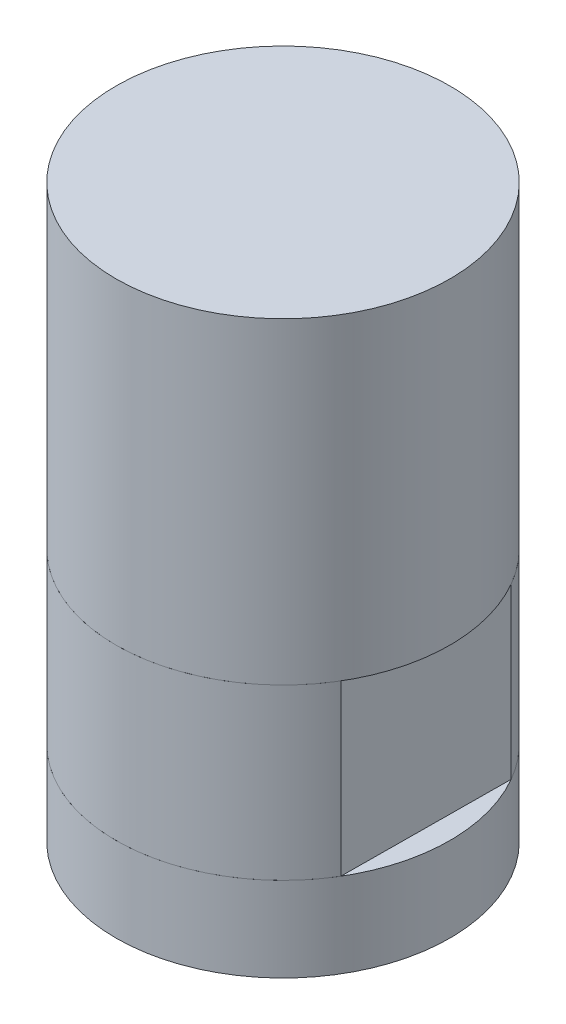
from build123d import *

# Parameters (mm, degrees)
SKETCH1_R           = 3.95
BOSS_EXTRUDE1_DEPTH = 2
BOSS_EXTRUDE2_DEPTH = 4
SKETCH4_R           = 3.95
BOSS_EXTRUDE3_DEPTH = 2
CUT_EXTRUDE1_DEPTH  = 10.757304956
SKETCH6_R           = 3.95
BOSS_EXTRUDE4_DEPTH = 5.5


with BuildPart() as part:
    # Sketch1 → Boss-Extrude1 (new body)
    with BuildSketch(Plane(origin=(0, 0, 0), x_dir=(1, 0, 0), z_dir=(0, 1, 0))):
        Circle(SKETCH1_R)
    extrude(amount=BOSS_EXTRUDE1_DEPTH)


with BuildPart() as body_2:
    # Sketch3 → Boss-Extrude2 (new body)
    with BuildSketch(Plane(origin=(0, 2, 0), x_dir=(1, 0, 0), z_dir=(0, 1, 0))):
        with BuildLine():
            Line((-2.025641026, 3.391058601), (1.974358974, 3.421170361))
            ThreePointArc((1.974358974, 3.421170361), (2.793071786, 2.793071786), (3.421170361, 1.974358974))
            Line((3.421170361, 1.974358974), (3.391058601, -2.025641026))
            ThreePointArc((3.391058601, -2.025641026), (-2.793071786, -2.793071786), (-2.025641026, 3.391058601))
        make_face()
    extrude(amount=BOSS_EXTRUDE2_DEPTH)


with BuildPart() as body_3:
    # Sketch4 → Boss-Extrude3 (new body)
    with BuildSketch(Plane(origin=(0, 6, 0), x_dir=(1, 0, 0), z_dir=(0, 1, 0))):
        Circle(SKETCH4_R)
    extrude(amount=BOSS_EXTRUDE3_DEPTH)


with BuildPart() as cut_extrude1_tool:
    # Sketch5 → Cut-Extrude1 (new, through all)
    with BuildSketch(Plane(origin=(0, 8, 0), x_dir=(1, 0, 0), z_dir=(0, 1, 0))):
        with BuildLine():
            Line((1.676190476, 1.424915958), (1.676190476, -1.424915958))
            ThreePointArc((1.676190476, -1.424915958), (-2.2, 0), (1.676190476, 1.424915958))
        make_face()
    extrude(amount=-CUT_EXTRUDE1_DEPTH)


with BuildPart() as part_1:
    add(part.part)

    # Cut-Extrude1: cut by cut_extrude1_tool
    add(cut_extrude1_tool.part, mode=Mode.SUBTRACT)


with BuildPart() as body_2_1:
    add(body_2.part)

    # Cut-Extrude1: cut by cut_extrude1_tool
    add(cut_extrude1_tool.part, mode=Mode.SUBTRACT)


with BuildPart() as body_3_1:
    add(body_3.part)

    # Cut-Extrude1: cut by cut_extrude1_tool
    add(cut_extrude1_tool.part, mode=Mode.SUBTRACT)

    # Sketch6 → Boss-Extrude4 (add)
    with BuildSketch(Plane(origin=(0, 8, 0), x_dir=(1, 0, 0), z_dir=(0, 1, 0))):
        Circle(SKETCH6_R)
    extrude(amount=BOSS_EXTRUDE4_DEPTH)


solid = Compound([part_1.part, body_2_1.part, body_3_1.part])
